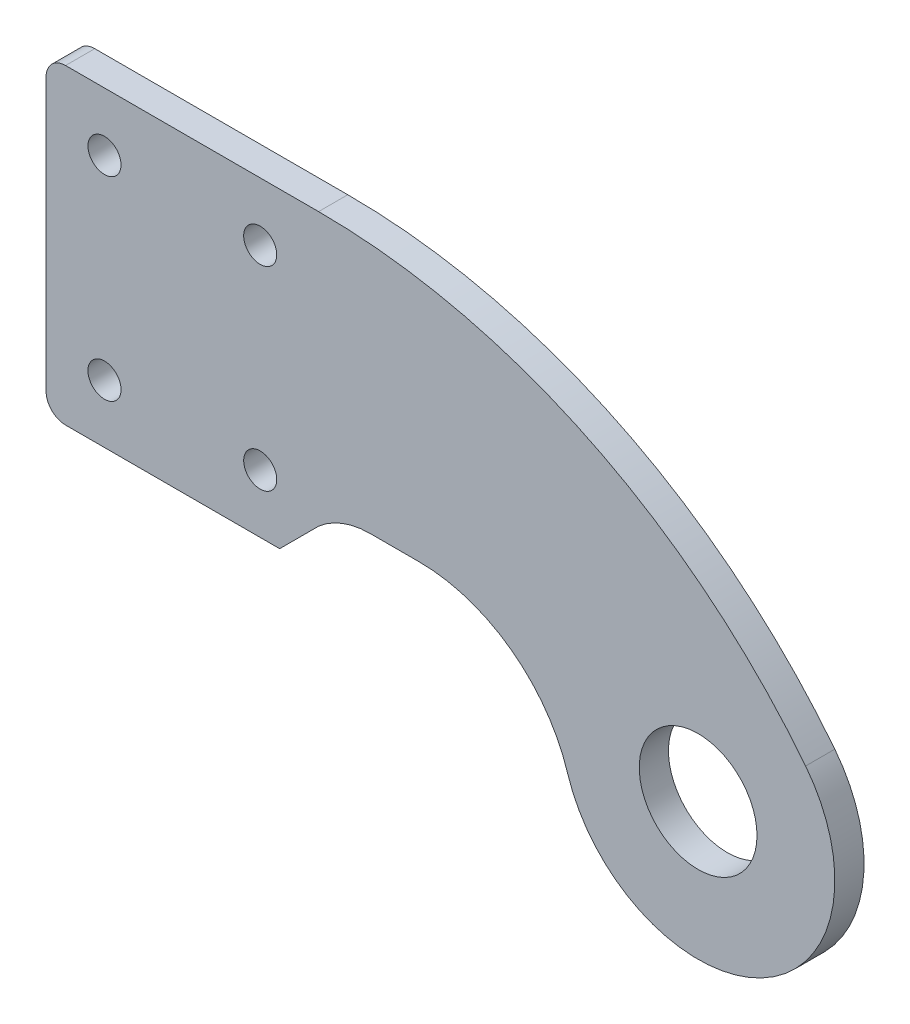
from build123d import *

# Parameters (mm, degrees)
ESQUISSE1_R             = 3.025
ESQUISSE1_R_2           = 0.85
BOSS_EXTRU_1_DEPTH      = 0.75
CONG_2_R                = 1
ESQUISSE2_W             = 12.492816186
ESQUISSE2_H             = 3
ENL_V_MAT_EXTRU_1_DEPTH = 38.373118682
CHANFREIN1_SIZE         = 2
CONG_3_R                = 4
CONG_4_R                = 8


with BuildPart() as part:
    # Esquisse1 → Boss.-Extru.1 (new, symmetric)
    with BuildSketch(Plane.XY):
        with BuildLine():
            Line((-33.5, 16.5), (-19.5, 16.5))
            ThreePointArc((-19.5, 16.5), (-5.589776158, 13.29943825), (5.522918298, 4.34142816))
            ThreePointArc((5.522918298, 4.34142816), (2.059102622, -6.716451548), (-7.007183814, 0.5))
            Line((-7.007183814, 0.5), (-19.5, 0.5))
            Line((-19.5, 0.5), (-33.5, 0.5))
            Line((-33.5, 0.5), (-33.5, 16.5))
        make_face()
        Circle(ESQUISSE1_R, mode=Mode.SUBTRACT)
        with Locations((-30.5, 13.5)):
            Circle(ESQUISSE1_R_2, mode=Mode.SUBTRACT)
        with Locations((-22.5, 13.5)):
            Circle(ESQUISSE1_R_2, mode=Mode.SUBTRACT)
        with Locations((-22.5, 3.5)):
            Circle(ESQUISSE1_R_2, mode=Mode.SUBTRACT)
        with Locations((-30.5, 3.5)):
            Circle(ESQUISSE1_R_2, mode=Mode.SUBTRACT)
    extrude(amount=BOSS_EXTRU_1_DEPTH, both=True)

    # Congé2
    cong_2_edges = [part.edges().sort_by_distance(p)[0] for p in [
        (-33.5, 16.5, 0),
        (-33.5, 0.5, 0),
    ]]
    fillet(cong_2_edges, radius=CONG_2_R)

    # Esquisse2 → Enlèv. mat.-Extru.1 (cut, through all)
    with BuildSketch(Plane.XY.offset(0.75)):
        with Locations((-13.253591907, 2)):
            Rectangle(ESQUISSE2_W, ESQUISSE2_H)
    extrude(amount=-ENL_V_MAT_EXTRU_1_DEPTH, mode=Mode.SUBTRACT)

    # Chanfrein1
    chanfrein1_edges = [part.edges().sort_by_distance(p)[0] for p in [
        (-19.5, 0.5, 0),
    ]]
    chamfer(chanfrein1_edges, length=CHANFREIN1_SIZE)

    # Congé3
    # the kernel refuses this fillet: 4 mm, written as the material it adds along each edge
    with BuildSketch(Plane(origin=(-19.5, 3.5, 0.75), x_dir=(0, -1, 0), z_dir=(0, 0, -1))) as cong_3_piece_1:
        with BuildLine():
            CenterArc((4, -2.645751311), CONG_3_R, 138.590377891, 41.409622109)
            Line((0, -2.645751311), (-0.08, -2.645751311))
            Line((-0.08, -2.645751311), (-0.08, 0))
            Line((-0.08, 0), (0, 0.08))
            ThreePointArc((0, 0.08), (0.5, 0.08), (0.94, 0.052915026))
            Line((0.94, 0.052915026), (1, 0))
        make_face()
    extrude(amount=1.5)

    # Congé4
    cong_4_edges = [part.edges().sort_by_distance(p)[0] for p in [
        (-7.007183814, 3.5, 0),
    ]]
    fillet(cong_4_edges, radius=CONG_4_R)


solid = part.part
